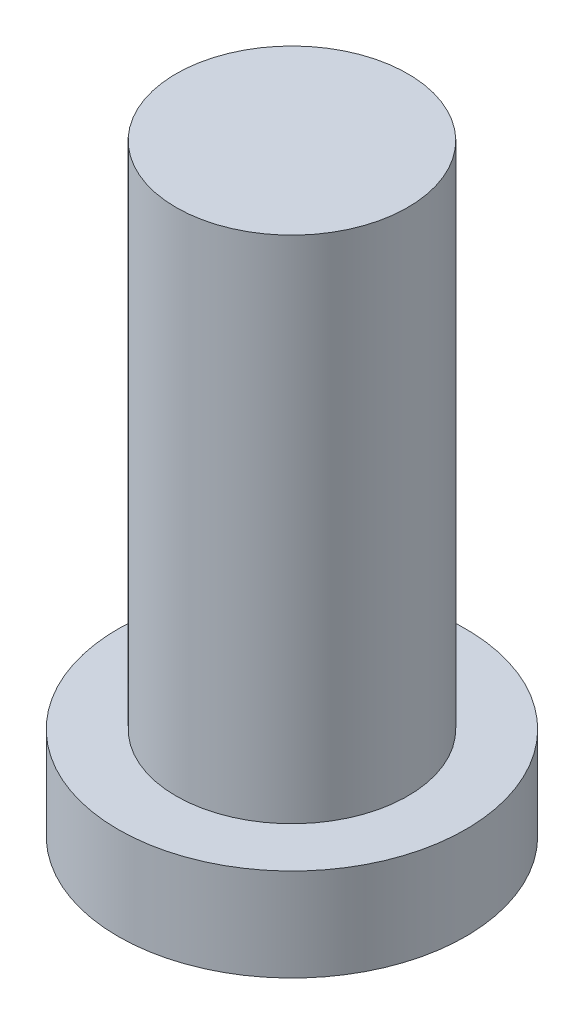
from build123d import *

# Parameters (mm, degrees)
SKETCH1_R           = 7.5
BOSS_EXTRUDE3_DEPTH = 4
SKETCH4_R           = 5
BOSS_EXTRUDE4_DEPTH = 22


with BuildPart() as part:
    # Sketch1 → Boss-Extrude3 (new body)
    with BuildSketch(Plane(origin=(0, 0, 0), x_dir=(1, 0, 0), z_dir=(0, 1, 0))):
        Circle(SKETCH1_R)
    extrude(amount=BOSS_EXTRUDE3_DEPTH)

    # Sketch4 → Boss-Extrude4 (add)
    with BuildSketch(Plane(origin=(0, 4, 0), x_dir=(1, 0, 0), z_dir=(0, 1, 0))):
        Circle(SKETCH4_R)
    extrude(amount=BOSS_EXTRUDE4_DEPTH)


solid = part.part
